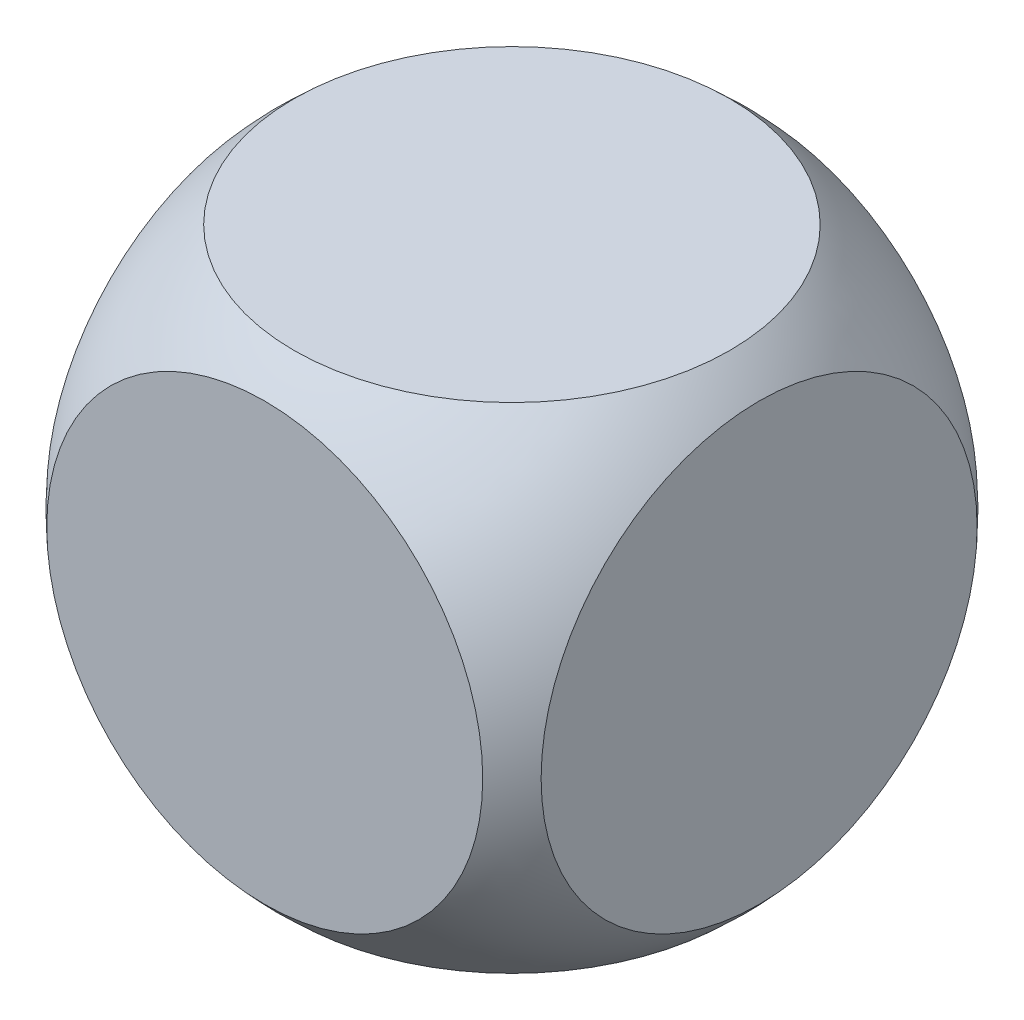
from build123d import *

# Parameters (mm, degrees)
P_IDAT_VYSUNUT_M1_DEPTH      = 30
P_IDAT_VYSUNUT_M1_DEPTH_BACK = 30
SKICA2_W                     = 60
SKICA2_H                     = 60


with BuildPart() as part:
    # Skica1 → Rotovat1 (revolve)
    with BuildSketch(Plane.XY):
        with BuildLine():
            Line((0, -40), (0, 40))
            ThreePointArc((0, 40), (40, 0), (0, -40))
        make_face()
    revolve(axis=Axis((0, -40, 0), (0, 1, 0)))


with BuildPart() as body_2:
    # Skica2 → Přidat vysunutím1 (new, two sides: drawn at the far end of the back side and taken through both)
    with BuildSketch(Plane.XY.offset(-P_IDAT_VYSUNUT_M1_DEPTH_BACK)):
        Rectangle(SKICA2_W, SKICA2_H)
    extrude(amount=P_IDAT_VYSUNUT_M1_DEPTH + P_IDAT_VYSUNUT_M1_DEPTH_BACK)


with BuildPart() as part_1:
    add(part.part)

    # Průsečík3: read off the stored shape, not the designer's step
    # Průsečík3: intersect body 2
    add(body_2.part, mode=Mode.INTERSECT)


solid = part_1.part
